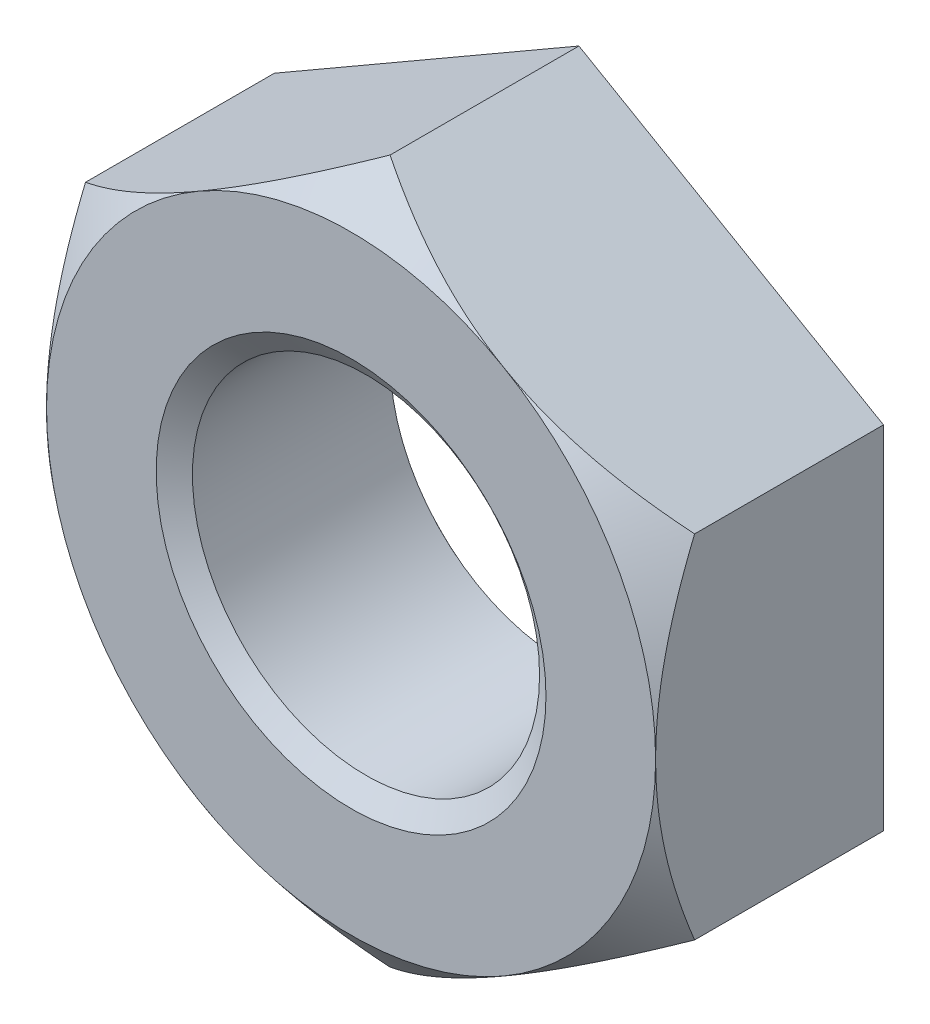
from build123d import *

# Parameters (mm, degrees)
THREADSCHEMATIC_START     = -29.6926
THREADSCHEMATIC_OUTLINE_R = 22.62124
THREADSCHEMATIC_DEPTH     = 29.6926


# Read off the part's stored shape, not the designer's step: ThreadSchematic
with BuildPart() as part:
    # ThreadSchematic outline → ThreadSchematic (new body)
    with BuildSketch(Plane.XY.offset(THREADSCHEMATIC_START)):
        Polygon((39.6875, 22.913588808), (0, 45.827177617), (-39.6875, 22.913588808), (-39.6875, -22.913588808), (0, -45.827177617), (39.6875, -22.913588808), align=None)
        Circle(THREADSCHEMATIC_OUTLINE_R, mode=Mode.SUBTRACT)
    extrude(amount=THREADSCHEMATIC_DEPTH)

    # Sketch2 → Single-Chamfer (revolve, cut)
    with BuildSketch(Plane(origin=(0, 0, 0), x_dir=(0, 0, -1), z_dir=(1, 0, 0))):
        Polygon((0, 39.6875), (-12.7, 39.6875), (-12.7, 58.527177617), (5.08, 58.527177617), (5.08, 45.827177617), align=None)
    revolve(axis=Axis((0, 0, 0), (0, 0, -1)), mode=Mode.SUBTRACT)

    # Sketch3 → EndChamfer (revolve, cut)
    with BuildSketch(Plane(origin=(0, 0, 0), x_dir=(0, 0, -1), z_dir=(1, 0, 0)), mode=Mode.PRIVATE) as endchamfer_sk:
        Polygon((29.6672, 25.4), (27.526920431, 22.343364), (29.718, 22.343364), (29.718, 25.4), align=None)
        Polygon((-0.0508, 25.4), (0, 25.4), (2.140279569, 22.343364), (-0.0508, 22.343364), align=None)
    revolve(endchamfer_sk.sketch.rotate(Axis((0, 0, -25.037505729), (0, 0, -1)), 90), axis=Axis((0, 0, -25.037505729), (0, 0, -1)), mode=Mode.SUBTRACT)


solid = part.part
